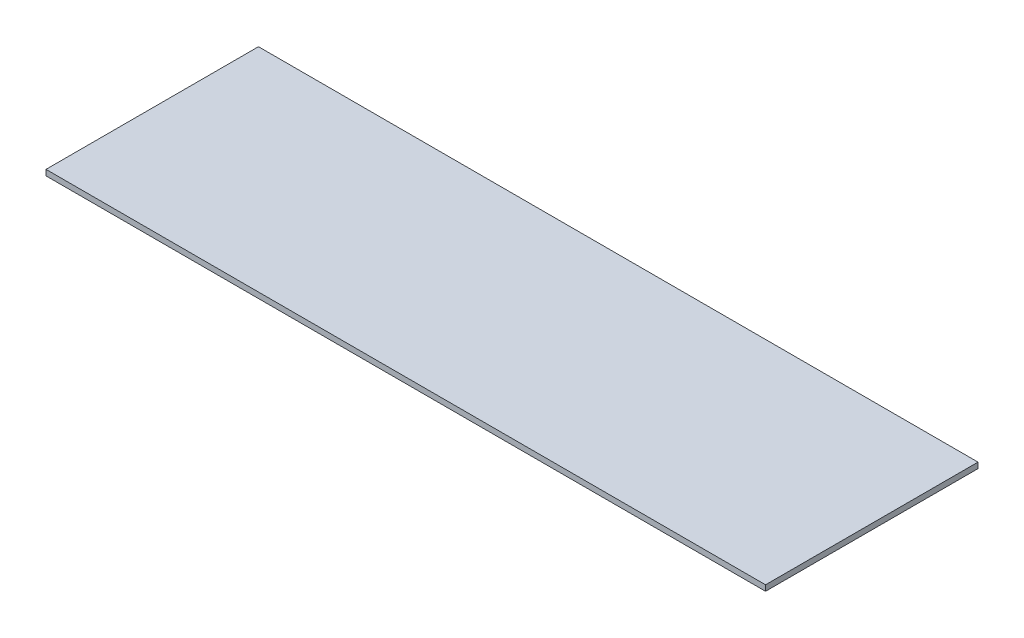
from build123d import *

# Parameters (mm, degrees)
SKETCH1_W           = 508
SKETCH1_H           = 150
BOSS_EXTRUDE1_DEPTH = 4


with BuildPart() as part:
    # Sketch1 → Boss-Extrude1 (new body)
    with BuildSketch(Plane(origin=(0, 0, 0), x_dir=(1, 0, 0), z_dir=(0, 1, 0))):
        with Locations((254, 75)):
            Rectangle(SKETCH1_W, SKETCH1_H)
    extrude(amount=BOSS_EXTRUDE1_DEPTH)


solid = part.part
